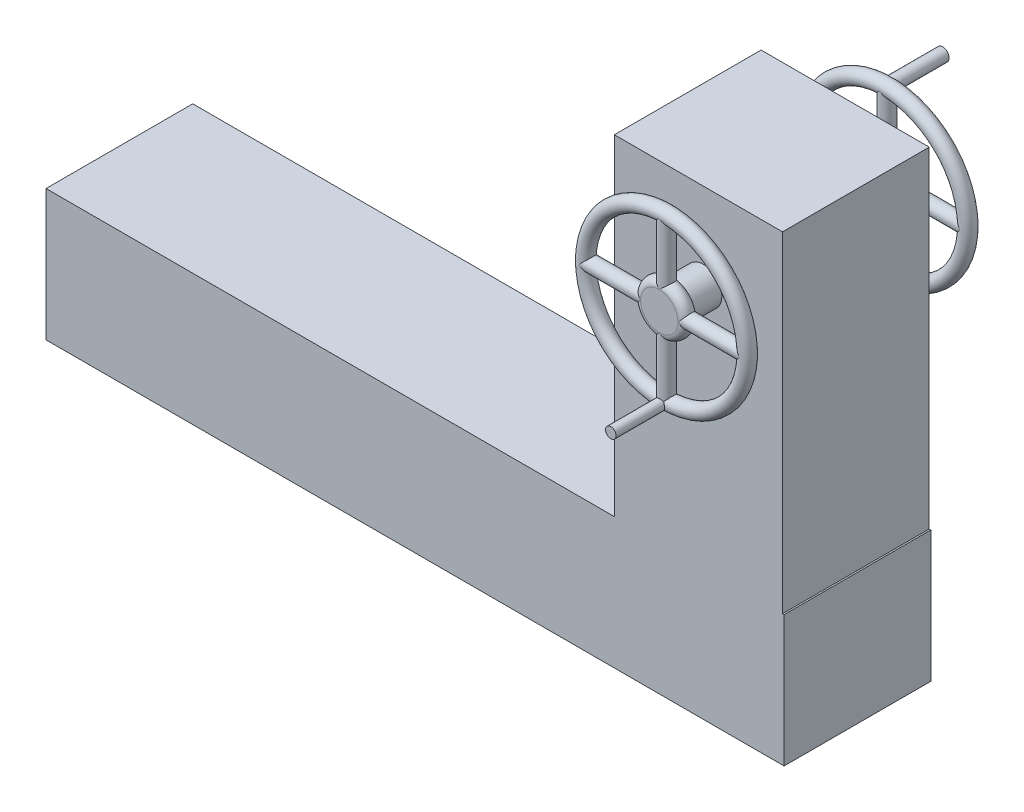
from build123d import *
from build123d.topology import SkipClean

# Parameters (mm, degrees)
SKETCH3_W                                  = 1408.472826490197
SKETCH3_H                                  = 1353.2385980003892
BOSS_EXTRUDE1_DEPTH                        = 7619.999999999998
SKETCH4_W                                  = 1736.1779351219302
SKETCH4_H                                  = 1408.472826490197
BOSS_EXTRUDE2_DEPTH                        = 3414.5220000000036
SKETCH5_R                                  = 190.49999999999963
BOSS_EXTRUDE3_DEPTH                        = 381
SKETCH9_R                                  = 74.99999999999997
BOSS_EXTRUDE4_REACH                        = 10873.871
BOSS_EXTRUDE4_END_MAJOR_RADIUS             = 833.102715867211
BOSS_EXTRUDE4_END_MINOR_RADIUS             = 74.99999999999997
SKETCH11_R                                 = 74.50000000000004
BOSS_EXTRUDE4_DIRECTION_2_REACH            = 10873.871
BOSS_EXTRUDE4_DIRECTION_2_END_MAJOR_RADIUS = 833.102715867211
BOSS_EXTRUDE4_DIRECTION_2_END_MINOR_RADIUS = 74.99999999999997
SKETCH12_R                                 = 74.50000000000047
BOSS_EXTRUDE5_DEPTH                        = 1640.0000000000027
SKETCH13_R                                 = 54.428630862515774
BOSS_EXTRUDE6_DEPTH                        = 500
BOSS_EXTRUDE6_DIRECTION_2_REACH            = 18172.502
BOSS_EXTRUDE6_DIRECTION_2_END_MAJOR_RADIUS = 833.102715867211
BOSS_EXTRUDE6_DIRECTION_2_END_MINOR_RADIUS = 74.99999999999997
SKETCH14_R                                 = 66.20613337773315
BOSS_EXTRUDE7_DEPTH                        = 500
BOSS_EXTRUDE7_DIRECTION_2_REACH            = 18245.961
BOSS_EXTRUDE7_DIRECTION_2_END_MAJOR_RADIUS = 833.102715867211
BOSS_EXTRUDE7_DIRECTION_2_END_MINOR_RADIUS = 74.99999999999997
SCALE1_SCALE                               = 0.1


with BuildPart() as part:
    # Sketch3 → Boss-Extrude1 (new body)
    with BuildSketch(Plane(origin=(8230.252532952023, 0, 0), x_dir=(0, 0, -1), z_dir=(1, 0, 0))):
        with Locations((-53.181164945957676, 4296.162990231951)):
            Rectangle(SKETCH3_W, SKETCH3_H)
    extrude(amount=BOSS_EXTRUDE1_DEPTH)

    # Sketch4 → Boss-Extrude2 (add)
    with BuildSketch(Plane(origin=(0, 4972.782289232146, 0), x_dir=(1, 0, 0), z_dir=(0, 1, 0))):
        with Locations((14965.939580545395, -53.181164945957676)):
            Rectangle(SKETCH4_W, SKETCH4_H)
    extrude(amount=BOSS_EXTRUDE2_DEPTH)

    # Sketch5 → Boss-Extrude3 (add)
    with BuildSketch(Plane.XY.offset(757.4175781910561)):
        with Locations(Location((15017.261067543977, 7497.949253982513, 0), (0, 0, 180))):
            Circle(SKETCH5_R)
    extrude(amount=BOSS_EXTRUDE3_DEPTH)

    # Sketch10 → Revolve5 (revolve)
    with BuildSketch(Plane(origin=(15017.261067543977, 0, 0), x_dir=(0, 0, -1), z_dir=(1, 0, 0)), mode=Mode.PRIVATE) as revolve5_sk:
        with BuildLine():
            Line((-1063.687875886069, 7690.557071625964), (-1063.687875886069, 7497.700941941704))
            Line((-1063.687875886069, 7497.700941941704), (-1213.1472804960435, 7497.700941941704))
            Line((-1213.1472804960435, 7497.700941941704), (-1213.1472804960435, 7690.557071625964))
            ThreePointArc((-1213.1472804960435, 7690.557071625964), (-1138.4175781910562, 7765.286773930951), (-1063.687875886069, 7690.557071625964))
        make_face()
    revolve(revolve5_sk.sketch.rotate(Axis((15017.261067543977, 7497.700941941704, 1213.1472804960435), (0, 0, -1)), 90), axis=Axis((15017.261067543977, 7497.700941941704, 1213.1472804960435), (0, 0, -1)))



with BuildPart() as body_2:
    # Sketch9 → Revolve3 (revolve)
    with BuildSketch(Plane(origin=(15017.261067543977, 0, 0), x_dir=(0, 0, -1), z_dir=(1, 0, 0)), mode=Mode.PRIVATE) as revolve3_sk:
        with Locations((-1138.4175781910562, 8331.051969849725)):
            Circle(SKETCH9_R)
    revolve(revolve3_sk.sketch.rotate(Axis((15017.261067543977, 7497.949253982513, 1138.4175781910562), (0, 0, 1)), 90), axis=Axis((15017.261067543977, 7497.949253982513, 1138.4175781910562), (0, 0, 1)))


with BuildPart() as part_1:
    add(part.part)

    add(body_2.part)  # Boss-Extrude4 merges body 2
    # Boss-Extrude4: up to this torus (the profile starts outside it)
    boss_extrude4_end = Plane(origin=(15017.261067543977, 7497.949253982513, 1138.4175781910562), z_dir=(0, 0, -1)) * Torus(BOSS_EXTRUDE4_END_MAJOR_RADIUS, BOSS_EXTRUDE4_END_MINOR_RADIUS, mode=Mode.PRIVATE)
    # Sketch11 → Boss-Extrude4 (add, up to the surface)
    with BuildSketch(Plane(origin=(15017.261067543977, 0, 0), x_dir=(0, 0, -1), z_dir=(1, 0, 0)), mode=Mode.PRIVATE) as boss_extrude4_sk1:
        with Locations(Location((-1138.4175781910562, 7497.949253982513, 0), (0, 0, 303.143566617))):
            Circle(SKETCH11_R)
    boss_extrude4_tool1 = extrude(boss_extrude4_sk1.sketch, amount=BOSS_EXTRUDE4_REACH, mode=Mode.PRIVATE) - boss_extrude4_end
    add(boss_extrude4_tool1.solids().sort_by_distance((15017.261068, 7497.949254, 1138.417578))[0])

    # Boss-Extrude4 direction 2: up to this torus (the profile starts outside it)
    boss_extrude4_direction_2_end = Plane(origin=(15017.261067543977, 7497.949253982513, 1138.4175781910562), z_dir=(0, 0, -1)) * Torus(BOSS_EXTRUDE4_DIRECTION_2_END_MAJOR_RADIUS, BOSS_EXTRUDE4_DIRECTION_2_END_MINOR_RADIUS, mode=Mode.PRIVATE)
    # Sketch11 → Boss-Extrude4 direction 2 (add, up to the surface)
    with BuildSketch(Plane(origin=(15017.261067543977, 0, 0), x_dir=(0, 0, -1), z_dir=(1, 0, 0)), mode=Mode.PRIVATE) as boss_extrude4_direction_2_sk1:
        with Locations(Location((-1138.4175781910562, 7497.949253982513, 0), (0, 0, 303.143566617))):
            Circle(SKETCH11_R)
    boss_extrude4_direction_2_tool1 = extrude(boss_extrude4_direction_2_sk1.sketch, amount=-BOSS_EXTRUDE4_DIRECTION_2_REACH, mode=Mode.PRIVATE) - boss_extrude4_direction_2_end
    add(boss_extrude4_direction_2_tool1.solids().sort_by_distance((15017.261068, 7497.949254, 1138.417578))[0])

    # Sketch12 → Boss-Extrude5 (add)
    with BuildSketch(Plane(origin=(0, 8331.051969849725, 0), x_dir=(1, 0, 0), z_dir=(0, 1, 0))):
        with Locations(Location((15017.261067543977, -1138.4175781910562, 0), (0, 0, 139.783847439))):
            Circle(SKETCH12_R)
    extrude(amount=-BOSS_EXTRUDE5_DEPTH)

    # Mirror2: part across plane


with BuildPart() as part_2:
    add(part_1.part)
    add(part_1.part.mirror(Plane.XY))

    # Sketch13 → Boss-Extrude6 (add)
    with BuildSketch(Plane.XY.offset(1213.1472804960435)):
        with Locations(Location((15017.261067543977, 6661.246024342433, 0), (0, 0, 130.952809939))):
            Circle(SKETCH13_R)
    extrude(amount=BOSS_EXTRUDE6_DEPTH)

    # Boss-Extrude6 direction 2: up to this torus (the profile starts outside it)
    with SkipClean():  # the faces are left unmerged after this step: merging them gives an invalid solid
        boss_extrude6_direction_2_end = Plane(origin=(15017.261067543977, 7497.949253982513, 1138.4175781910562), z_dir=(0, 0, -1)) * Torus(BOSS_EXTRUDE6_DIRECTION_2_END_MAJOR_RADIUS, BOSS_EXTRUDE6_DIRECTION_2_END_MINOR_RADIUS, mode=Mode.PRIVATE)
        # Sketch13 → Boss-Extrude6 direction 2 (add, up to the surface)
        with BuildSketch(Plane.XY.offset(1213.1472804960435), mode=Mode.PRIVATE) as boss_extrude6_direction_2_sk1:
            with Locations(Location((15017.261067543977, 6661.246024342433, 0), (0, 0, 130.952809939))):
                Circle(SKETCH13_R)
        boss_extrude6_direction_2_tool1 = extrude(boss_extrude6_direction_2_sk1.sketch, amount=-BOSS_EXTRUDE6_DIRECTION_2_REACH, mode=Mode.PRIVATE) - boss_extrude6_direction_2_end
        add(boss_extrude6_direction_2_tool1.solids().sort_by_distance((15017.261068, 6661.246024, 1213.14728))[0])
        add(boss_extrude6_direction_2_tool1.solids().sort_by_distance((15017.261068, 6661.246024, 1213.14728))[1])

    # Sketch14 → Boss-Extrude7 (add)
    with BuildSketch(Plane(origin=(0, 0, -1213.1472804960435), x_dir=(-1, 0, 0), z_dir=(0, 0, -1))):
        with Locations(Location((-15017.261067543977, 8331.051969849725, 0), (0, 0, 226.310090328))):
            Circle(SKETCH14_R)
    extrude(amount=BOSS_EXTRUDE7_DEPTH)

    # Boss-Extrude7 direction 2: up to this torus (the profile starts outside it)
    with SkipClean():  # the faces are left unmerged after this step: merging them gives an invalid solid
        boss_extrude7_direction_2_end = Plane(origin=(15017.261067543977, 7497.949253982513, -1138.4175781910562), z_dir=(0, 0, 1)) * Torus(BOSS_EXTRUDE7_DIRECTION_2_END_MAJOR_RADIUS, BOSS_EXTRUDE7_DIRECTION_2_END_MINOR_RADIUS, mode=Mode.PRIVATE)
        # Sketch14 → Boss-Extrude7 direction 2 (add, up to the surface)
        with BuildSketch(Plane(origin=(0, 0, -1213.1472804960435), x_dir=(-1, 0, 0), z_dir=(0, 0, -1)), mode=Mode.PRIVATE) as boss_extrude7_direction_2_sk1:
            with Locations(Location((-15017.261067543977, 8331.051969849725, 0), (0, 0, 226.310090328))):
                Circle(SKETCH14_R)
        boss_extrude7_direction_2_tool1 = extrude(boss_extrude7_direction_2_sk1.sketch, amount=-BOSS_EXTRUDE7_DIRECTION_2_REACH, mode=Mode.PRIVATE) - boss_extrude7_direction_2_end
        add(boss_extrude7_direction_2_tool1.solids().sort_by_distance((15017.261068, 8331.05197, -1213.14728))[0])
        add(boss_extrude7_direction_2_tool1.solids().sort_by_distance((15017.261068, 8331.05197, -1213.14728))[1])


with BuildPart() as part_3:
    # Scale1: scaled about (0, 0, 0)
    add(part_2.part.scale(SCALE1_SCALE))


solid = part_3.part
